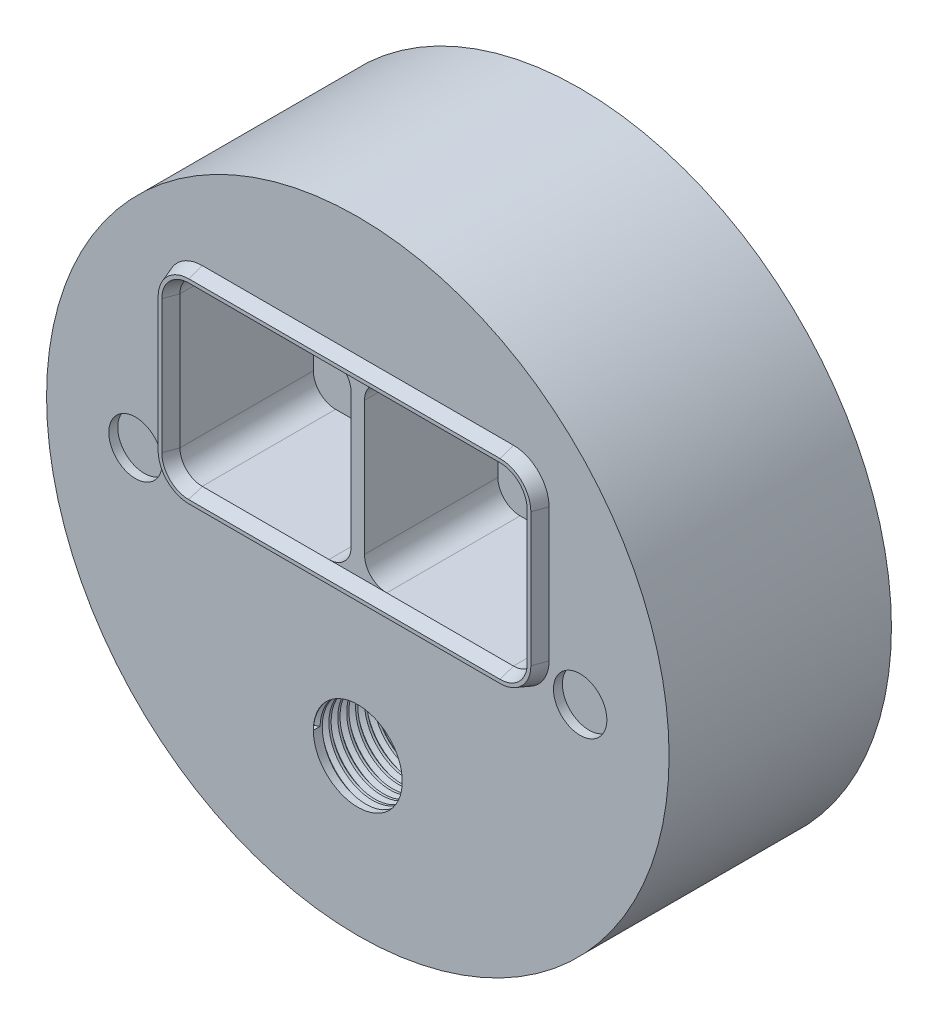
from build123d import *

# Parameters (mm, degrees)
SKETCH1_R           = 35
SKETCH1_R_2         = 5
SKETCH1_R_3         = 3
BOSS_EXTRUDE1_DEPTH = 25
THREAD1_PITCH       = 1
BOSS_EXTRUDE2_START = -25
SKETCH9_R           = 3
BOSS_EXTRUDE2_DEPTH = 24
CUT_EXTRUDE1_DEPTH  = 15
BOSS_EXTRUDE3_DEPTH = 15
BOSS_EXTRUDE4_DEPTH = 1.5
BOSS_EXTRUDE4_DRAFT = 20
CUT_EXTRUDE5_DEPTH  = 1
BOSS_EXTRUDE5_DEPTH = 1
BOSS_EXTRUDE6_DEPTH = 4


with BuildPart() as part:
    # Sketch1 → Boss-Extrude1 (new body)
    with BuildSketch(Plane.XY):
        Circle(SKETCH1_R)
        with Locations((0, -17.5)):
            Circle(SKETCH1_R_2, mode=Mode.SUBTRACT)
        with Locations((-25, 0)):
            Circle(SKETCH1_R_3, mode=Mode.SUBTRACT)
        with Locations(Location((25, 0, 0), (0, 0, 180))):
            Circle(SKETCH1_R_3, mode=Mode.SUBTRACT)
    extrude(amount=BOSS_EXTRUDE1_DEPTH)

    # Thread1: the profile of Thread Profile1 profile screwed along a right-hand helix of 25 turns, 8 arcs to a turn; built about Z, then put on its axis
    thread1_z = Axis((0, 0, 0), (0, 0, 1))
    thread1_corners = [(4.9997, 0, -0.000173205), (5.541265875, 0, 0.312499999), (5.541265875, 0, 0.437499999), (4.9997, 0, 0.750173202)]
    with BuildLine(mode=Mode.PRIVATE) as thread1_profile:
        Line(thread1_corners[0], thread1_corners[1])
        Line(thread1_corners[1], thread1_corners[2])
        Line(thread1_corners[2], thread1_corners[3])
        Line(thread1_corners[3], thread1_corners[0])
    thread1_cap = Face(thread1_profile.wire())
    thread1_turn_angles = [0, 22.5, 45, 67.5, 90, 112.5, 135, 157.5, 180, 202.5, 225, 247.5, 270, 292.5, 315, 337.5, 360]
    thread1_turn_weights = [1, 0.9238795325112867, 1, 0.9238795325112867, 1, 0.9238795325112867, 1, 0.9238795325112867, 1, 0.9238795325112867, 1, 0.9238795325112867, 1, 0.9238795325112867, 1, 0.9238795325112867, 1]
    thread1_turn_rails = [Edge.make_bspline([Vector(p[0], p[1], 0).rotate(thread1_z, thread1_turn_angles[k]) / thread1_turn_weights[k] + Vector(0, 0, p[2] + THREAD1_PITCH * thread1_turn_angles[k] / 360) for k in range(17)], [0, 0, 0, 1, 1, 2, 2, 3, 3, 4, 4, 5, 5, 6, 6, 7, 7, 8, 8, 8], 2, thread1_turn_weights) for p in thread1_corners]
    thread1_turn_sides = [Face.make_surface_from_curves(thread1_turn_rails[p[0]], thread1_turn_rails[p[1]]) for p in [(0, 1), (1, 2), (2, 3), (3, 0)]]
    thread1 = Plane(origin=(0, -17.5, 25), x_dir=(-1, 0, 0), z_dir=(0, 0, -1)) * Solid(Shell([*[p.moved(Location((0, 0, THREAD1_PITCH * i))) for i in range(25) for p in thread1_turn_sides], thread1_cap, thread1_cap.rotate(thread1_z, 9000).moved(Location((0, 0, THREAD1_PITCH * 9000 / 360)))]))
    add(thread1, mode=Mode.SUBTRACT)

    # Sketch9 → Boss-Extrude2 (add)
    with BuildSketch(Plane.XY.offset(25).offset(BOSS_EXTRUDE2_START)):
        with Locations((-25, 0)):
            Circle(SKETCH9_R)
        with Locations(Location((25, 0, 0), (0, 0, 180))):
            Circle(SKETCH9_R)
    extrude(amount=BOSS_EXTRUDE2_DEPTH)

    # Sketch10 → Cut-Extrude1 (cut)
    with BuildSketch(Plane.XY.offset(25)):
        with BuildLine():
            Line((-17.5, 20), (17.5, 20))
            ThreePointArc((17.5, 20), (19.267766953, 19.267766953), (20, 17.5))
            Line((20, 17.5), (20, 2.5))
            ThreePointArc((20, 2.5), (19.267766953, 0.732233047), (17.5, 0))
            Line((17.5, 0), (-17.5, 0))
            ThreePointArc((-17.5, 0), (-19.267766953, 0.732233047), (-20, 2.5))
            Line((-20, 2.5), (-20, 17.5))
            ThreePointArc((-20, 17.5), (-19.267766953, 19.267766953), (-17.5, 20))
        make_face()
    extrude(amount=-CUT_EXTRUDE1_DEPTH, mode=Mode.SUBTRACT)

    # Sketch11 → Boss-Extrude3 (add)
    with BuildSketch(Plane.XY.offset(10)):
        with BuildLine():
            Line((-0.75, 17.5), (-0.75, 2.5))
            ThreePointArc((-0.75, 2.5), (-1.482233047, 0.732233047), (-3.25, 0))
            Line((-3.25, 0), (3.25, 0))
            ThreePointArc((3.25, 0), (1.482233047, 0.732233047), (0.75, 2.5))
            Line((0.75, 2.5), (0.75, 17.5))
            ThreePointArc((0.75, 17.5), (1.482233047, 19.267766953), (3.25, 20))
            Line((3.25, 20), (-3.25, 20))
            ThreePointArc((-3.25, 20), (-1.482233047, 19.267766953), (-0.75, 17.5))
        make_face()
    extrude(amount=BOSS_EXTRUDE3_DEPTH)


with BuildPart() as boss_extrude4_tool:
    # Sketch12 → Boss-Extrude4 (with draft: the straight prism first)
    with BuildSketch(Plane.XY.offset(25)):
        with BuildLine():
            Line((-3.25, -1.5), (3.25, -1.5))
            Line((3.25, -1.5), (17.5, -1.5))
            ThreePointArc((17.5, -1.5), (20.328427125, -0.328427125), (21.5, 2.5))
            Line((21.5, 2.5), (21.5, 17.5))
            ThreePointArc((21.5, 17.5), (20.328427125, 20.328427125), (17.5, 21.5))
            Line((17.5, 21.5), (3.25, 21.5))
            Line((3.25, 21.5), (-3.25, 21.5))
            Line((-3.25, 21.5), (-17.5, 21.5))
            ThreePointArc((-17.5, 21.5), (-20.328427125, 20.328427125), (-21.5, 17.5))
            Line((-21.5, 17.5), (-21.5, 2.5))
            ThreePointArc((-21.5, 2.5), (-20.328427125, -0.328427125), (-17.5, -1.5))
            Line((-17.5, -1.5), (-3.25, -1.5))
        make_face()
        with BuildLine():
            Line((-3.25, 20), (-17.5, 20))
            ThreePointArc((-17.5, 20), (-19.267766953, 19.267766953), (-20, 17.5))
            Line((-20, 17.5), (-20, 2.5))
            ThreePointArc((-20, 2.5), (-19.267766953, 0.732233047), (-17.5, 0))
            Line((-17.5, 0), (-3.25, 0))
            Line((-3.25, 0), (3.25, 0))
            Line((3.25, 0), (17.5, 0))
            ThreePointArc((17.5, 0), (19.267766953, 0.732233047), (20, 2.5))
            Line((20, 2.5), (20, 17.5))
            ThreePointArc((20, 17.5), (19.267766953, 19.267766953), (17.5, 20))
            Line((17.5, 20), (3.25, 20))
            Line((3.25, 20), (-3.25, 20))
        make_face(mode=Mode.SUBTRACT)
    extrude(amount=BOSS_EXTRUDE4_DEPTH)
    # Boss-Extrude4: the draft: its side faces are tilted about the plane it starts from
    boss_extrude4_sides = [boss_extrude4_tool.faces().sort_by_distance(p)[0] for p in [
        (0, 21.5, 25.75),
        (-19.267766953, 19.267766953, 25.75),
        (-20, 10, 25.75),
        (-19.267766953, 0.732233047, 25.75),
        (0, 0, 25.75),
        (19.267766953, 0.732233047, 25.75),
        (20, 10, 25.75),
        (19.267766953, 19.267766953, 25.75),
        (0, 20, 25.75),
        (21.5, 10, 25.75),
        (20.328427125, -0.328427125, 25.75),
        (0, -1.5, 25.75),
        (-20.328427125, -0.328427125, 25.75),
        (-21.5, 10, 25.75),
        (20.328427125, 20.328427125, 25.75),
        (-20.328427125, 20.328427125, 25.75),
    ]]
    draft(boss_extrude4_sides, Plane.XY.offset(25), BOSS_EXTRUDE4_DRAFT)


with BuildPart() as part_1:
    add(part.part)

    # Boss-Extrude4: add boss_extrude4_tool
    add(boss_extrude4_tool.part)

    # Sketch14 → Cut-Extrude5 (cut)
    with BuildSketch(Plane.XY):
        with BuildLine():
            Line((14.561063068, 30), (14.061063068, 30))
            ThreePointArc((14.061063068, 30), (13.353956287, 29.707106781), (13.061063068, 29))
            Line((13.061063068, 29), (13.061063068, -29))
            ThreePointArc((13.061063068, -29), (13.353956287, -29.707106781), (14.061063068, -30))
            Line((14.061063068, -30), (14.561063068, -30))
            ThreePointArc((14.561063068, -30), (15.268169849, -29.707106781), (15.561063068, -29))
            Line((15.561063068, -29), (15.561063068, 29))
            ThreePointArc((15.561063068, 29), (15.268169849, 29.707106781), (14.561063068, 30))
        make_face()
    extrude(amount=CUT_EXTRUDE5_DEPTH, mode=Mode.SUBTRACT)

    # Sketch15 → Boss-Extrude5 (add)
    with BuildSketch(Plane(origin=(0, 0, 1), x_dir=(-1, 0, 0), z_dir=(0, 0, -1))):
        Polygon((-15.225342238, 29.249763799), (-15.225342238, 28.88992326), (-14.311063068, 28.262294414), (-13.396783898, 28.88992326), (-13.396783898, 29.249763799), (-14.311063068, 28.622134953), align=None)
        Polygon((-13.396783898, 26.749763799), (-13.396783898, 26.38992326), (-14.311063068, 25.762294414), (-15.225342238, 26.38992326), (-15.225342238, 26.749763799), (-14.311063068, 26.122134953), align=None)
        Polygon((-13.396783898, 24.249763799), (-13.396783898, 23.88992326), (-14.311063068, 23.262294414), (-15.225342238, 23.88992326), (-15.225342238, 24.249763799), (-14.311063068, 23.622134953), align=None)
        Polygon((-13.396783898, 21.749763799), (-13.396783898, 21.38992326), (-14.311063068, 20.762294414), (-15.225342238, 21.38992326), (-15.225342238, 21.749763799), (-14.311063068, 21.122134953), align=None)
        Polygon((-13.396783898, 19.249763799), (-13.396783898, 18.88992326), (-14.311063068, 18.262294414), (-15.225342238, 18.88992326), (-15.225342238, 19.249763799), (-14.311063068, 18.622134953), align=None)
        Polygon((-13.396783898, 16.749763799), (-13.396783898, 16.38992326), (-14.311063068, 15.762294414), (-15.225342238, 16.38992326), (-15.225342238, 16.749763799), (-14.311063068, 16.122134953), align=None)
        Polygon((-13.396783898, 14.249763799), (-13.396783898, 13.88992326), (-14.311063068, 13.262294414), (-15.225342238, 13.88992326), (-15.225342238, 14.249763799), (-14.311063068, 13.622134953), align=None)
        Polygon((-13.396783898, 11.749763799), (-13.396783898, 11.38992326), (-14.311063068, 10.762294414), (-15.225342238, 11.38992326), (-15.225342238, 11.749763799), (-14.311063068, 11.122134953), align=None)
        Polygon((-13.396783898, 9.249763799), (-13.396783898, 8.88992326), (-14.311063068, 8.262294414), (-15.225342238, 8.88992326), (-15.225342238, 9.249763799), (-14.311063068, 8.622134953), align=None)
        Polygon((-13.396783898, 6.749763799), (-13.396783898, 6.38992326), (-14.311063068, 5.762294414), (-15.225342238, 6.38992326), (-15.225342238, 6.749763799), (-14.311063068, 6.122134953), align=None)
        Polygon((-13.396783898, 4.249763799), (-13.396783898, 3.88992326), (-14.311063068, 3.262294414), (-15.225342238, 3.88992326), (-15.225342238, 4.249763799), (-14.311063068, 3.622134953), align=None)
        Polygon((-13.396783898, 1.749763799), (-13.396783898, 1.38992326), (-14.311063068, 0.762294414), (-15.225342238, 1.38992326), (-15.225342238, 1.749763799), (-14.311063068, 1.122134953), align=None)
        Polygon((-13.396783898, -0.750236201), (-13.396783898, -1.11007674), (-14.311063068, -1.737705586), (-15.225342238, -1.11007674), (-15.225342238, -0.750236201), (-14.311063068, -1.377865047), align=None)
        Polygon((-13.396783898, -3.250236201), (-13.396783898, -3.61007674), (-14.311063068, -4.237705586), (-15.225342238, -3.61007674), (-15.225342238, -3.250236201), (-14.311063068, -3.877865047), align=None)
        Polygon((-13.396783898, -5.750236201), (-13.396783898, -6.11007674), (-14.311063068, -6.737705586), (-15.225342238, -6.11007674), (-15.225342238, -5.750236201), (-14.311063068, -6.377865047), align=None)
        Polygon((-13.396783898, -8.250236201), (-13.396783898, -8.61007674), (-14.311063068, -9.237705586), (-15.225342238, -8.61007674), (-15.225342238, -8.250236201), (-14.311063068, -8.877865047), align=None)
        Polygon((-13.396783898, -10.750236201), (-13.396783898, -11.11007674), (-14.311063068, -11.737705586), (-15.225342238, -11.11007674), (-15.225342238, -10.750236201), (-14.311063068, -11.377865047), align=None)
        Polygon((-13.396783898, -13.250236201), (-13.396783898, -13.61007674), (-14.311063068, -14.237705586), (-15.225342238, -13.61007674), (-15.225342238, -13.250236201), (-14.311063068, -13.877865047), align=None)
        Polygon((-13.396783898, -15.750236201), (-13.396783898, -16.11007674), (-14.311063068, -16.737705586), (-15.225342238, -16.11007674), (-15.225342238, -15.750236201), (-14.311063068, -16.377865047), align=None)
        Polygon((-13.396783898, -18.250236201), (-13.396783898, -18.61007674), (-14.311063068, -19.237705586), (-15.225342238, -18.61007674), (-15.225342238, -18.250236201), (-14.311063068, -18.877865047), align=None)
        Polygon((-13.396783898, -20.750236201), (-13.396783898, -21.11007674), (-14.311063068, -21.737705586), (-15.225342238, -21.11007674), (-15.225342238, -20.750236201), (-14.311063068, -21.377865047), align=None)
        Polygon((-13.396783898, -23.250236201), (-13.396783898, -23.61007674), (-14.311063068, -24.237705586), (-15.225342238, -23.61007674), (-15.225342238, -23.250236201), (-14.311063068, -23.877865047), align=None)
        Polygon((-13.396783898, -25.750236201), (-13.396783898, -26.11007674), (-14.311063068, -26.737705586), (-15.225342238, -26.11007674), (-15.225342238, -25.750236201), (-14.311063068, -26.377865047), align=None)
        Polygon((-13.396783898, -28.250236201), (-13.396783898, -28.61007674), (-14.311063068, -29.237705586), (-15.225342238, -28.61007674), (-15.225342238, -28.250236201), (-14.311063068, -28.877865047), align=None)
    extrude(amount=BOSS_EXTRUDE5_DEPTH)

    # Sketch16 → Boss-Extrude6 (add)
    with BuildSketch(Plane(origin=(0, 0, 0), x_dir=(-1, 0, 0), z_dir=(0, 0, -1))):
        with BuildLine():
            Line((2.75, -32.5), (1.25, -32.5))
            Line((1.25, -32.5), (1.25, -26))
            Line((1.25, -26), (-1.25, -26))
            Line((-1.25, -26), (-1.25, -32.5))
            Line((-1.25, -32.5), (-2.75, -32.5))
            ThreePointArc((-2.75, -32.5), (-3.457106781, -32.207106781), (-3.75, -31.5))
            Line((-3.75, -31.5), (-3.75, -26))
            ThreePointArc((-3.75, -26), (-3.457106781, -25.292893219), (-2.75, -25))
            Line((-2.75, -25), (-1.25, -25))
            Line((-1.25, -25), (1.25, -25))
            Line((1.25, -25), (2.75, -25))
            ThreePointArc((2.75, -25), (3.457106781, -25.292893219), (3.75, -26))
            Line((3.75, -26), (3.75, -31.5))
            ThreePointArc((3.75, -31.5), (3.457106781, -32.207106781), (2.75, -32.5))
        make_face()
    extrude(amount=BOSS_EXTRUDE6_DEPTH)


solid = part_1.part
